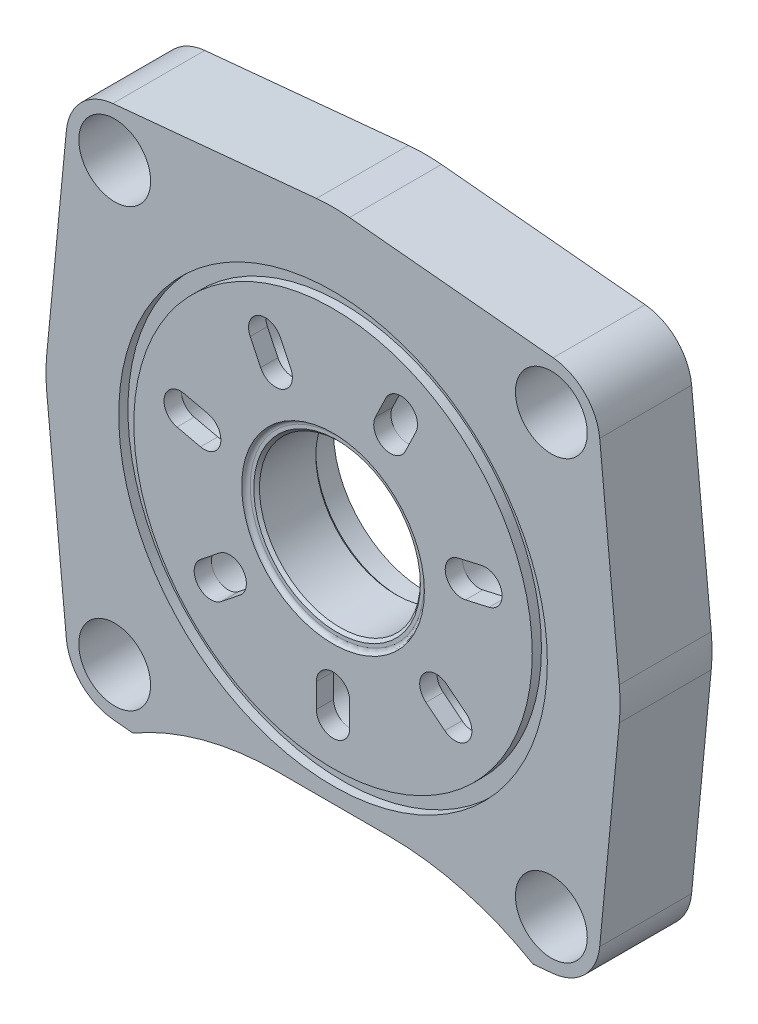
from build123d import *

# Parameters (mm, degrees)
SKETCH1_R           = 14
SKETCH1_R_2         = 6.25
BOSS_EXTRUDE1_DEPTH = 16
SKETCH2_R           = 15.9
CUT_EXTRUDE1_DEPTH  = 0.7
SKETCH3_R           = 37.3
SKETCH3_R_2         = 34.675
CUT_EXTRUDE2_DEPTH  = 1.6
CUT_EXTRUDE4_START  = -4.5
SKETCH8_R           = 15.9
CUT_EXTRUDE4_DEPTH  = 4.5
CUT_EXTRUDE5_DEPTH  = 8.5
CUT_EXTRUDE6_DEPTH  = 72.360142937
CHAMFER1_SIZE       = 0.5
FILLET1_R           = 0.8
FILLET2_R           = 30
CUT_EXTRUDE7_START  = -13
SKETCH11_R          = 5
CUT_EXTRUDE7_DEPTH  = 86.444823388
CIRPATTERN1_COUNT   = 7
CHAMFER2_SIZE       = 1


with BuildPart() as part:
    # Sketch1 → Boss-Extrude1 (new body)
    with BuildSketch(Plane.XY):
        with BuildLine():
            Line((0, 50.1), (-38.314754723, 46.410708736))
            ThreePointArc((-38.314754723, 46.410708736), (-43.816103981, 43.816103981), (-46.410708736, 38.314754723))
            Line((-46.410708736, 38.314754723), (-50.1, 0))
            Line((-50.1, 0), (-46.410708736, -38.314754723))
            ThreePointArc((-46.410708736, -38.314754723), (-43.816103981, -43.816103981), (-38.314754723, -46.410708736))
            Line((-38.314754723, -46.410708736), (0, -50.1))
            Line((0, -50.1), (38.314754723, -46.410708736))
            ThreePointArc((38.314754723, -46.410708736), (43.816103981, -43.816103981), (46.410708736, -38.314754723))
            Line((46.410708736, -38.314754723), (50.1, 0))
            Line((50.1, 0), (46.410708736, 38.314754723))
            ThreePointArc((46.410708736, 38.314754723), (43.816103981, 43.816103981), (38.314754723, 46.410708736))
            Line((38.314754723, 46.410708736), (0, 50.1))
        make_face()
        Circle(SKETCH1_R, mode=Mode.SUBTRACT)
        with Locations((-38, 38)):
            Circle(SKETCH1_R_2, mode=Mode.SUBTRACT)
        with Locations(Location((38, 38, 0), (0, 0, 180))):
            Circle(SKETCH1_R_2, mode=Mode.SUBTRACT)
        with Locations((38, -38)):
            Circle(SKETCH1_R_2, mode=Mode.SUBTRACT)
        with Locations(Location((-38, -38, 0), (0, 0, 180))):
            Circle(SKETCH1_R_2, mode=Mode.SUBTRACT)
        with BuildLine():
            Line((2.9, -23), (2.9, -27.2))
            ThreePointArc((2.9, -27.2), (0, -30.1), (-2.9, -27.2))
            Line((-2.9, -27.2), (-2.9, -23))
            ThreePointArc((-2.9, -23), (0, -20.1), (2.9, -23))
        make_face(mode=Mode.SUBTRACT)
        with BuildLine():
            Line((-16.174003671, -16.607576742), (-19.457695898, -19.22623391))
            ThreePointArc((-19.457695898, -19.22623391), (-23.533127622, -18.767043036), (-23.073936749, -14.691611311))
            Line((-23.073936749, -14.691611311), (-19.790244522, -12.072954144))
            ThreePointArc((-19.790244522, -12.072954144), (-15.714812798, -12.532145017), (-16.174003671, -16.607576742))
        make_face(mode=Mode.SUBTRACT)
        with BuildLine():
            Line((-23.068652689, 2.290690536), (-27.16334992, 3.225278458))
            ThreePointArc((-27.16334992, 3.225278458), (-29.345330157, 6.697880112), (-25.872728503, 8.879860349))
            Line((-25.872728503, 8.879860349), (-21.778031272, 7.945272426))
            ThreePointArc((-21.778031272, 7.945272426), (-19.596051035, 4.472670773), (-23.068652689, 2.290690536))
        make_face(mode=Mode.SUBTRACT)
        with BuildLine():
            Line((-12.592135717, 19.464021118), (-14.414447421, 23.248090364))
            ThreePointArc((-14.414447421, 23.248090364), (-13.059900547, 27.119162924), (-9.188827987, 25.76461605))
            Line((-9.188827987, 25.76461605), (-7.366516283, 21.980546805))
            ThreePointArc((-7.366516283, 21.980546805), (-8.721063156, 18.109474245), (-12.592135717, 19.464021118))
        make_face(mode=Mode.SUBTRACT)
        with BuildLine():
            Line((7.366516283, 21.980546805), (9.188827987, 25.76461605))
            ThreePointArc((9.188827987, 25.76461605), (13.059900547, 27.119162924), (14.414447421, 23.248090364))
            Line((14.414447421, 23.248090364), (12.592135717, 19.464021118))
            ThreePointArc((12.592135717, 19.464021118), (8.721063156, 18.109474245), (7.366516283, 21.980546805))
        make_face(mode=Mode.SUBTRACT)
        with BuildLine():
            Line((21.778031272, 7.945272426), (25.872728503, 8.879860349))
            ThreePointArc((25.872728503, 8.879860349), (29.345330157, 6.697880112), (27.16334992, 3.225278458))
            Line((27.16334992, 3.225278458), (23.068652689, 2.290690536))
            ThreePointArc((23.068652689, 2.290690536), (19.596051035, 4.472670773), (21.778031272, 7.945272426))
        make_face(mode=Mode.SUBTRACT)
        with BuildLine():
            Line((19.790244522, -12.072954144), (23.073936749, -14.691611311))
            ThreePointArc((23.073936749, -14.691611311), (23.533127622, -18.767043036), (19.457695898, -19.22623391))
            Line((19.457695898, -19.22623391), (16.174003671, -16.607576742))
            ThreePointArc((16.174003671, -16.607576742), (15.714812798, -12.532145017), (19.790244522, -12.072954144))
        make_face(mode=Mode.SUBTRACT)
    extrude(amount=-BOSS_EXTRUDE1_DEPTH)

    # Sketch2 → Cut-Extrude1 (cut)
    with BuildSketch(Plane.XY):
        Circle(SKETCH2_R)
    extrude(amount=-CUT_EXTRUDE1_DEPTH, mode=Mode.SUBTRACT)

    # Sketch3 → Cut-Extrude2 (cut)
    with BuildSketch(Plane.XY):
        Circle(SKETCH3_R)
        Circle(SKETCH3_R_2, mode=Mode.SUBTRACT)
    extrude(amount=-CUT_EXTRUDE2_DEPTH, mode=Mode.SUBTRACT)

    # Sketch8 → Cut-Extrude4 (cut)
    with BuildSketch(Plane(origin=(0, 0, -16), x_dir=(-1, 0, 0), z_dir=(0, 0, -1)).offset(CUT_EXTRUDE4_START)):
        with Locations(Location((0, 0, 0), (0, 0, 180))):
            Circle(SKETCH8_R)
    extrude(amount=CUT_EXTRUDE4_DEPTH, mode=Mode.SUBTRACT)

    # Sketch9 → Cut-Extrude5 (cut)
    with BuildSketch(Plane.XY):
        with BuildLine():
            Line((-9.71, -39.980418901), (9.71, -39.980418901))
            ThreePointArc((9.71, -39.980418901), (22.715935957, -41.701586791), (34.82645594, -46.746593705))
            Line((34.82645594, -46.746593705), (0, -50.1))
            Line((0, -50.1), (-34.82645594, -46.746593705))
            ThreePointArc((-34.82645594, -46.746593705), (-22.715935957, -41.701586791), (-9.71, -39.980418901))
        make_face()
    extrude(amount=-CUT_EXTRUDE5_DEPTH, mode=Mode.SUBTRACT)

    # Sketch10 → Cut-Extrude6 (cut, through all)
    with BuildSketch(Plane.XY.offset(-8.5)):
        with BuildLine():
            Line((-26.5, -47.548340223), (0, -50.1))
            Line((0, -50.1), (26.5, -47.548340223))
            ThreePointArc((26.5, -47.548340223), (19.652918631, -45.988815018), (12.654876886, -45.403961314))
            ThreePointArc((12.654876886, -45.403961314), (0, -44.6), (-12.654876886, -45.403961314))
            ThreePointArc((-12.654876886, -45.403961314), (-19.652918631, -45.988815018), (-26.5, -47.548340223))
        make_face()
    extrude(amount=-CUT_EXTRUDE6_DEPTH, mode=Mode.SUBTRACT)

    # Chamfer1
    chamfer1_edges = [part.edges().sort_by_distance(p)[0] for p in [
        (-14, 0, -0.7),
        (-14, 0, -11.5),
    ]]
    chamfer(chamfer1_edges, length=CHAMFER1_SIZE)

    # Fillet1
    # the kernel refuses this fillet: 0.8 mm, written as the material it adds along each edge
    with BuildSketch(Plane(origin=(0, 0, -0.7), x_dir=(1, 0, 0), z_dir=(0, -1, 0))) as fillet1_piece_1:
        with BuildLine():
            CenterArc((15.106274607, 0.8), FILLET1_R, 270, 82.819244219)
            Line((15.9, 0.7), (15.915874508, 0.698))
            ThreePointArc((15.915874508, 0.698), (15.916, 0.35), (15.916, 0))
            Line((15.916, 0), (15.9, -0.016))
            Line((15.9, -0.016), (15.106274607, -0.016))
            Line((15.106274607, -0.016), (15.106274607, 0))
        make_face()
    revolve(axis=Axis((0, 0, -0.7), (0, 0, 1)))
    with BuildSketch(Plane(origin=(0, 0, -11.5), x_dir=(1, 0, 0), z_dir=(0, 1, 0))) as fillet1_piece_2:
        with BuildLine():
            CenterArc((15.9 - FILLET1_R, FILLET1_R), FILLET1_R, 270, 90)
            Line((15.9, FILLET1_R), (15.9 + FILLET1_R * 0.02, FILLET1_R))
            Line((15.9 + FILLET1_R * 0.02, FILLET1_R), (15.9 + FILLET1_R * 0.02, -FILLET1_R * 0.02))
            Line((15.9 + FILLET1_R * 0.02, -FILLET1_R * 0.02), (15.9 - FILLET1_R, -FILLET1_R * 0.02))
            Line((15.9 - FILLET1_R, -FILLET1_R * 0.02), (15.9 - FILLET1_R, 0))
        make_face()
    revolve(axis=Axis((0, 0, -11.5), (0, 0, -1)))

    # Fillet2
    fillet2_edges = [part.edges().sort_by_distance(p)[0] for p in [
        (50.1, 0, -8),
        (-50.1, 0, -8),
        (0, 50.1, -8),
    ]]
    fillet(fillet2_edges, radius=FILLET2_R)

    # Sketch11 → Cut-Extrude7 (cut)
    with BuildSketch(Plane(origin=(0, 0, -16), x_dir=(-1, 0, 0), z_dir=(0, 0, -1)).offset(CUT_EXTRUDE7_START)):
        with Locations(Location((0, -25.1, 0), (0, 0, 180))):
            Circle(SKETCH11_R)
    cut_extrude7 = extrude(amount=CUT_EXTRUDE7_DEPTH, mode=Mode.SUBTRACT)

    # CirPattern1: Cut-Extrude7 ×7 about axis
    cirpattern1_axis = Axis((0, 0, 0), (0, 0, 1))
    for i in range(1, CIRPATTERN1_COUNT):
        add(cut_extrude7.rotate(cirpattern1_axis, i * 360 / CIRPATTERN1_COUNT), mode=Mode.SUBTRACT)

    # Chamfer2
    chamfer2_edges = [part.edges().sort_by_distance(p)[0] for p in [
        (-5, -25.1, -16),
        (16.506521201, -19.558751439, -16),
        (25.583295266, 0.710635881, -16),
        (15.395326191, 20.444899889, -16),
        (-6.385637512, 24.78373728, -16),
        (-23.358085926, 10.459915003, -16),
        (-22.741419219, -11.740436614, -16),
    ]]
    chamfer(chamfer2_edges, length=CHAMFER2_SIZE)


solid = part.part
